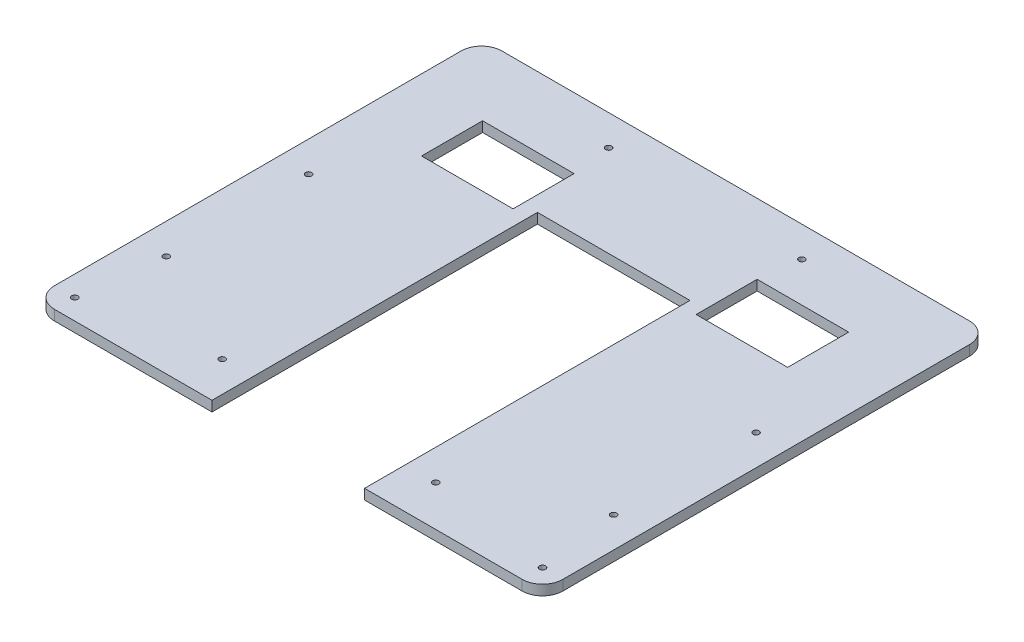
from build123d import *

# Parameters (mm, degrees)
EXTRUDE_1_DEPTH     = 5
SKETCH_4_W          = 45
SKETCH_4_H          = 30
CUT_EXTRUDE_3_DEPTH = 5
SKETCH_5_W          = 75
SKETCH_5_H          = 160
CUT_EXTRUDE_4_DEPTH = 5
CUT_EXTRUDE_5_REACH = 335.054
SKETCH_6_R          = 1.5
CUT_EXTRUDE_8_REACH = 335.054
SKETCH_8_R          = 1.5
CUT_EXTRUDE_9_REACH = 335.054
SKETCH_9_R          = 1.5


with BuildPart() as part:
    # 草图1 → 凸台-拉伸1 (new body)
    with BuildSketch(Plane(origin=(0, 0, 0), x_dir=(1, 0, 0), z_dir=(0, 1, 0))):
        with BuildLine():
            Line((10, 0), (240, 0))
            ThreePointArc((240, 0), (247.071067812, -2.928932188), (250, -10))
            Line((250, -10), (250, -210))
            ThreePointArc((250, -210), (247.071067812, -217.071067812), (240, -220))
            Line((240, -220), (10, -220))
            ThreePointArc((10, -220), (2.928932188, -217.071067812), (0, -210))
            Line((0, -210), (0, -10))
            ThreePointArc((0, -10), (2.928932188, -2.928932188), (10, 0))
        make_face()
    extrude(amount=EXTRUDE_1_DEPTH)

    # 草图4 → 切除-拉伸3 (cut)
    with BuildSketch(Plane.XZ):
        with Locations((192.5, 49.475)):
            Rectangle(SKETCH_4_W, SKETCH_4_H)
        with Locations((57.5, 49.475)):
            Rectangle(SKETCH_4_W, SKETCH_4_H)
    extrude(amount=-CUT_EXTRUDE_3_DEPTH, mode=Mode.SUBTRACT)

    # 草图5 → 切除-拉伸4 (cut)
    with BuildSketch(Plane.XZ):
        with Locations((125, 140)):
            Rectangle(SKETCH_5_W, SKETCH_5_H)
    extrude(amount=-CUT_EXTRUDE_4_DEPTH, mode=Mode.SUBTRACT)

    # 草图6 → 切除-拉伸5 (cut, up to next)
    with BuildSketch(Plane.XZ, mode=Mode.PRIVATE) as cut_extrude_5_sk1:
        with Locations((72.5, 200)):
            Circle(SKETCH_6_R)
    cut_extrude_5_tool1 = extrude(cut_extrude_5_sk1.sketch, amount=-CUT_EXTRUDE_5_REACH, mode=Mode.PRIVATE) & part.part
    # 草图6 → 切除-拉伸5 (cut, up to next)
    with BuildSketch(Plane.XZ, mode=Mode.PRIVATE) as cut_extrude_5_sk2:
        with Locations((177.5, 200)):
            Circle(SKETCH_6_R)
    cut_extrude_5_tool2 = extrude(cut_extrude_5_sk2.sketch, amount=-CUT_EXTRUDE_5_REACH, mode=Mode.PRIVATE) & part.part
    add(cut_extrude_5_tool1.solids().sort_by_distance((72.5, 0, 200))[0], mode=Mode.SUBTRACT)
    add(cut_extrude_5_tool2.solids().sort_by_distance((177.5, 0, 200))[0], mode=Mode.SUBTRACT)

    # 草图8 → 切除-拉伸8 (cut, up to next)
    with BuildSketch(Plane.XZ, mode=Mode.PRIVATE) as cut_extrude_8_sk1:
        with Locations((235, 170)):
            Circle(SKETCH_8_R)
    cut_extrude_8_tool1 = extrude(cut_extrude_8_sk1.sketch, amount=-CUT_EXTRUDE_8_REACH, mode=Mode.PRIVATE) & part.part
    # 草图8 → 切除-拉伸8 (cut, up to next)
    with BuildSketch(Plane.XZ, mode=Mode.PRIVATE) as cut_extrude_8_sk2:
        with Locations((235, 100)):
            Circle(SKETCH_8_R)
    cut_extrude_8_tool2 = extrude(cut_extrude_8_sk2.sketch, amount=-CUT_EXTRUDE_8_REACH, mode=Mode.PRIVATE) & part.part
    # 草图8 → 切除-拉伸8 (cut, up to next)
    with BuildSketch(Plane.XZ, mode=Mode.PRIVATE) as cut_extrude_8_sk3:
        with Locations((15, 100)):
            Circle(SKETCH_8_R)
    cut_extrude_8_tool3 = extrude(cut_extrude_8_sk3.sketch, amount=-CUT_EXTRUDE_8_REACH, mode=Mode.PRIVATE) & part.part
    # 草图8 → 切除-拉伸8 (cut, up to next)
    with BuildSketch(Plane.XZ, mode=Mode.PRIVATE) as cut_extrude_8_sk4:
        with Locations((15, 170)):
            Circle(SKETCH_8_R)
    cut_extrude_8_tool4 = extrude(cut_extrude_8_sk4.sketch, amount=-CUT_EXTRUDE_8_REACH, mode=Mode.PRIVATE) & part.part
    add(cut_extrude_8_tool1.solids().sort_by_distance((235, 0, 170))[0], mode=Mode.SUBTRACT)
    add(cut_extrude_8_tool2.solids().sort_by_distance((235, 0, 100))[0], mode=Mode.SUBTRACT)
    add(cut_extrude_8_tool3.solids().sort_by_distance((15, 0, 100))[0], mode=Mode.SUBTRACT)
    add(cut_extrude_8_tool4.solids().sort_by_distance((15, 0, 170))[0], mode=Mode.SUBTRACT)

    # 草图9 → 切除-拉伸9 (cut, up to next)
    with BuildSketch(Plane.XZ, mode=Mode.PRIVATE) as cut_extrude_9_sk1:
        with Locations((77.5, 15)):
            Circle(SKETCH_9_R)
    cut_extrude_9_tool1 = extrude(cut_extrude_9_sk1.sketch, amount=-CUT_EXTRUDE_9_REACH, mode=Mode.PRIVATE) & part.part
    # 草图9 → 切除-拉伸9 (cut, up to next)
    with BuildSketch(Plane.XZ, mode=Mode.PRIVATE) as cut_extrude_9_sk2:
        with Locations((10, 210)):
            Circle(SKETCH_9_R)
    cut_extrude_9_tool2 = extrude(cut_extrude_9_sk2.sketch, amount=-CUT_EXTRUDE_9_REACH, mode=Mode.PRIVATE) & part.part
    # 草图9 → 切除-拉伸9 (cut, up to next)
    with BuildSketch(Plane.XZ, mode=Mode.PRIVATE) as cut_extrude_9_sk3:
        with Locations((240, 210)):
            Circle(SKETCH_9_R)
    cut_extrude_9_tool3 = extrude(cut_extrude_9_sk3.sketch, amount=-CUT_EXTRUDE_9_REACH, mode=Mode.PRIVATE) & part.part
    # 草图9 → 切除-拉伸9 (cut, up to next)
    with BuildSketch(Plane.XZ, mode=Mode.PRIVATE) as cut_extrude_9_sk4:
        with Locations((172.5, 15)):
            Circle(SKETCH_9_R)
    cut_extrude_9_tool4 = extrude(cut_extrude_9_sk4.sketch, amount=-CUT_EXTRUDE_9_REACH, mode=Mode.PRIVATE) & part.part
    add(cut_extrude_9_tool1.solids().sort_by_distance((77.5, 0, 15))[0], mode=Mode.SUBTRACT)
    add(cut_extrude_9_tool2.solids().sort_by_distance((10, 0, 210))[0], mode=Mode.SUBTRACT)
    add(cut_extrude_9_tool3.solids().sort_by_distance((240, 0, 210))[0], mode=Mode.SUBTRACT)
    add(cut_extrude_9_tool4.solids().sort_by_distance((172.5, 0, 15))[0], mode=Mode.SUBTRACT)


solid = part.part
